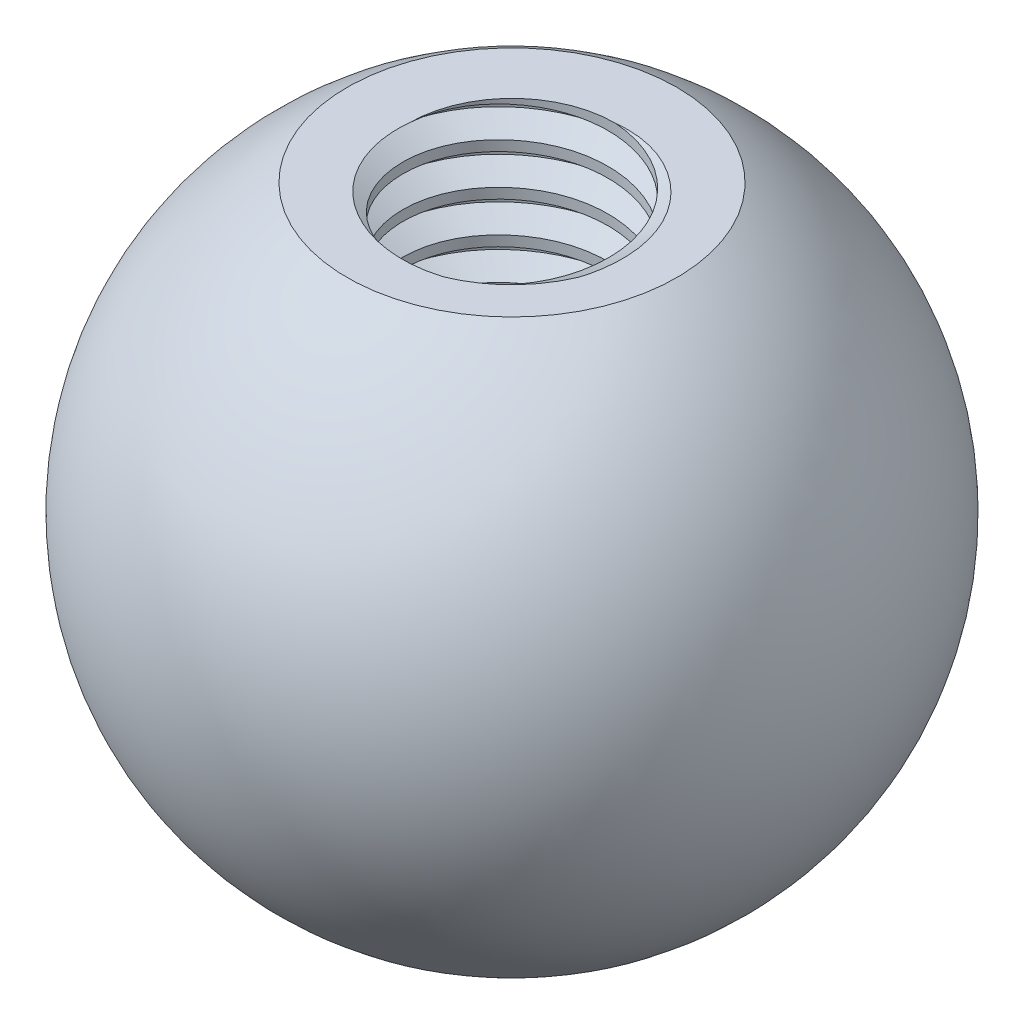
from build123d import *

# Parameters (mm, degrees)
TAP_DRILL_FOR_M3_TAP1_D     = 2.5
TAP_DRILL_FOR_M3_TAP1_DEPTH = 5
TAP_DRILL_FOR_M3_TAP1_TIP   = 0.751075774
THREAD1_PITCH               = 0.5


with BuildPart() as part:
    # Sketch1 → Revolve1 (revolve)
    with BuildSketch(Plane(origin=(0, 0, 0), x_dir=(0, 0, -1), z_dir=(1, 0, 0))):
        with BuildLine():
            Line((0, 0), (2, 0))
            ThreePointArc((2, 0), (3.863703305, -4.499377796), (0, -7.464101615))
            Line((0, -7.464101615), (0, 0))
        make_face()
    revolve(axis=Axis((0, -7.464101615, 0), (0, 1, 0)))

    # Tap Drill for M3 Tap1
    with Locations(Plane(origin=(0, 0, 0), x_dir=(1, 0, 0), z_dir=(0, 1, 0))):
        with Locations((0, 0)):
            Hole(TAP_DRILL_FOR_M3_TAP1_D / 2, depth=TAP_DRILL_FOR_M3_TAP1_DEPTH)
            with Locations((0, 0, -(TAP_DRILL_FOR_M3_TAP1_DEPTH + TAP_DRILL_FOR_M3_TAP1_TIP / 2))):  # 118° drill point
                Cone(0, TAP_DRILL_FOR_M3_TAP1_D / 2, TAP_DRILL_FOR_M3_TAP1_TIP, mode=Mode.SUBTRACT)

    # Thread1: the profile of Thread Profile1 profile screwed along a right-hand helix of 11 turns, 6 arcs to a turn; built about Z, then put on its axis
    thread1_z = Axis((0, 0, 0), (0, 0, 1))
    thread1_corners = [(1.2497, 0, -0.000173205), (1.520632937, 0, 0.156249999), (1.520632937, 0, 0.218749999), (1.2497, 0, 0.375173204)]
    with BuildLine(mode=Mode.PRIVATE) as thread1_profile:
        Line(thread1_corners[0], thread1_corners[1])
        Line(thread1_corners[1], thread1_corners[2])
        Line(thread1_corners[2], thread1_corners[3])
        Line(thread1_corners[3], thread1_corners[0])
    thread1_cap = Face(thread1_profile.wire())
    thread1_turn_angles = [0, 30, 60, 90, 120, 150, 180, 210, 240, 270, 300, 330, 360]
    thread1_turn_weights = [1, 0.8660254037844387, 1, 0.8660254037844387, 1, 0.8660254037844387, 1, 0.8660254037844387, 1, 0.8660254037844387, 1, 0.8660254037844387, 1]
    thread1_turn_rails = [Edge.make_bspline([Vector(p[0], p[1], 0).rotate(thread1_z, thread1_turn_angles[k]) / thread1_turn_weights[k] + Vector(0, 0, p[2] + THREAD1_PITCH * thread1_turn_angles[k] / 360) for k in range(13)], [0, 0, 0, 1, 1, 2, 2, 3, 3, 4, 4, 5, 5, 6, 6, 6], 2, thread1_turn_weights) for p in thread1_corners]
    thread1_turn_sides = [Face.make_surface_from_curves(thread1_turn_rails[p[0]], thread1_turn_rails[p[1]]) for p in [(0, 1), (1, 2), (2, 3), (3, 0)]]
    thread1 = Plane(origin=(0, 0.5, 0), x_dir=(-1, 0, 0), z_dir=(0, -1, 0)) * Solid(Shell([*[p.moved(Location((0, 0, THREAD1_PITCH * i))) for i in range(11) for p in thread1_turn_sides], thread1_cap, thread1_cap.rotate(thread1_z, 3960).moved(Location((0, 0, THREAD1_PITCH * 3960 / 360)))]))
    add(thread1, mode=Mode.SUBTRACT)


solid = part.part
